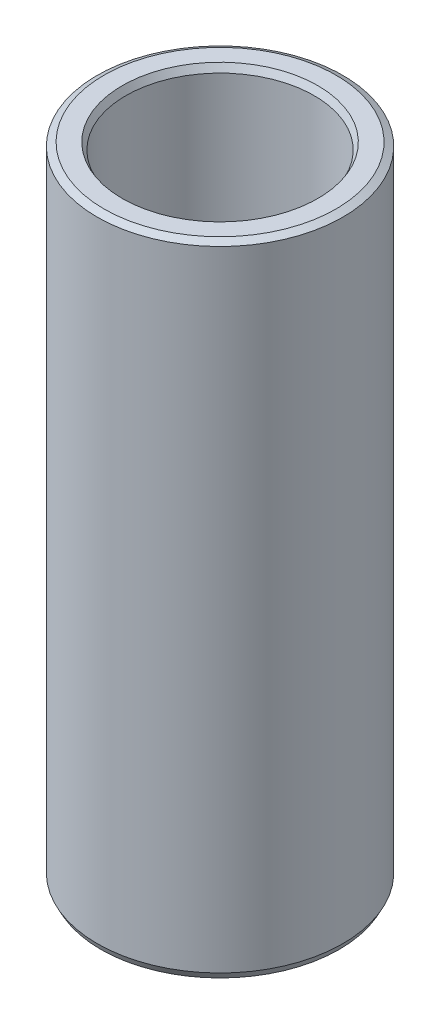
from build123d import *
from OCP.BRepFilletAPI import BRepFilletAPI_MakeChamfer

# Parameters (mm, degrees)
SKETCH1_R           = 45
BOSS_EXTRUDE1_DEPTH = 234.321484528
SKETCH2_R           = 34.507073241
CUT_EXTRUDE1_DEPTH  = 243.809715851
CHAMFER1_SIZE       = 1.324027066
CHAMFER1_SIZE2      = 2.511795752


with BuildPart() as part:
    # Sketch1 → Boss-Extrude1 (new body)
    with BuildSketch(Plane(origin=(0, 0, 0), x_dir=(1, 0, 0), z_dir=(0, 1, 0))):
        Circle(SKETCH1_R)
    extrude(amount=BOSS_EXTRUDE1_DEPTH)

    # Sketch2 → Cut-Extrude1 (cut, through all)
    with BuildSketch(Plane(origin=(0, 0, 0), x_dir=(1, 0, 0), z_dir=(0, 1, 0))):
        Circle(SKETCH2_R)
    extrude(amount=CUT_EXTRUDE1_DEPTH, mode=Mode.SUBTRACT)

    # Chamfer1: one chamfer whose edges measure the first distance from different faces: ONE call of the kernel's chamfer builder (chamfer() names one face for all edges)
    chamfer1_edges_1 = [part.edges().sort_by_distance(p)[0] for p in [
        (-34.507073241, 234.321484528, 0),
    ]]
    chamfer1_side_1 = [part.faces().sort_by_distance(p)[0] for p in [
        (-43.727207794, 234.321484528, 0),
    ]]
    chamfer1_edges_2 = [part.edges().sort_by_distance(p)[0] for p in [
        (-34.507073241, 0, 0),
    ]]
    chamfer1_side_2 = [part.faces().sort_by_distance(p)[0] for p in [
        (-34.507073241, 117.160742264, 0),
    ]]
    chamfer1_edges_3 = [part.edges().sort_by_distance(p)[0] for p in [
        (-45, 0, 0),
    ]]
    chamfer1_side_3 = [part.faces().sort_by_distance(p)[0] for p in [
        (-43.727207794, 0, 0),
    ]]
    chamfer1_edges_4 = [part.edges().sort_by_distance(p)[0] for p in [
        (-45, 234.321484528, 0),
    ]]
    chamfer1_side_4 = [part.faces().sort_by_distance(p)[0] for p in [
        (-45, 117.160742264, 0),
    ]]
    chamfer1 = BRepFilletAPI_MakeChamfer(part.part.solid().wrapped)
    for e in chamfer1_edges_1:
        chamfer1.Add(CHAMFER1_SIZE, CHAMFER1_SIZE2, e.wrapped, chamfer1_side_1[0].wrapped)  # the first distance lies on this face
    for e in chamfer1_edges_2:
        chamfer1.Add(CHAMFER1_SIZE, CHAMFER1_SIZE2, e.wrapped, chamfer1_side_2[0].wrapped)  # the first distance lies on this face
    for e in chamfer1_edges_3:
        chamfer1.Add(CHAMFER1_SIZE, CHAMFER1_SIZE2, e.wrapped, chamfer1_side_3[0].wrapped)  # the first distance lies on this face
    for e in chamfer1_edges_4:
        chamfer1.Add(CHAMFER1_SIZE, CHAMFER1_SIZE2, e.wrapped, chamfer1_side_4[0].wrapped)  # the first distance lies on this face
    add(Compound.cast(chamfer1.Shape()), mode=Mode.REPLACE)


solid = part.part
